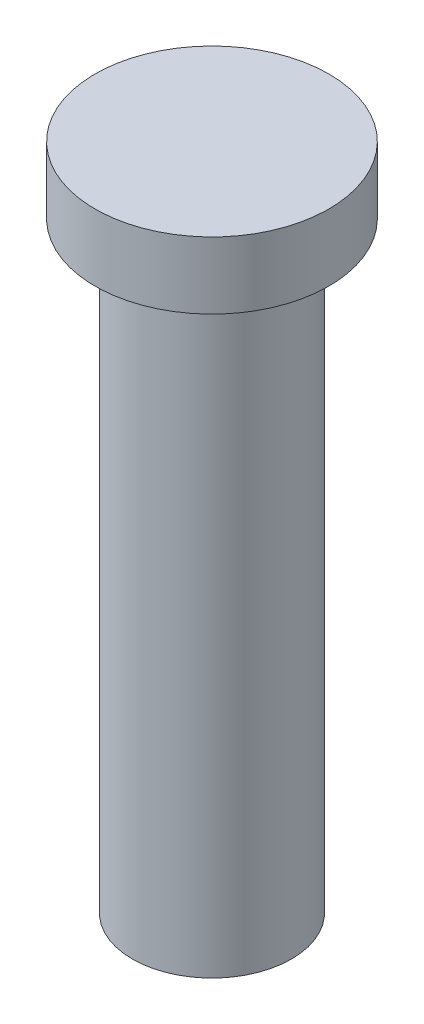
from build123d import *


with BuildPart() as part:
    # Sketch1 → Revolve1 (revolve)
    with BuildSketch(Plane.XY):
        Polygon((0, 0), (4.7625, 0), (4.7625, 36), (7, 36), (7, 40), (0, 40), align=None)
    revolve(axis=Axis((0, 0, 0), (0, 1, 0)))


solid = part.part
